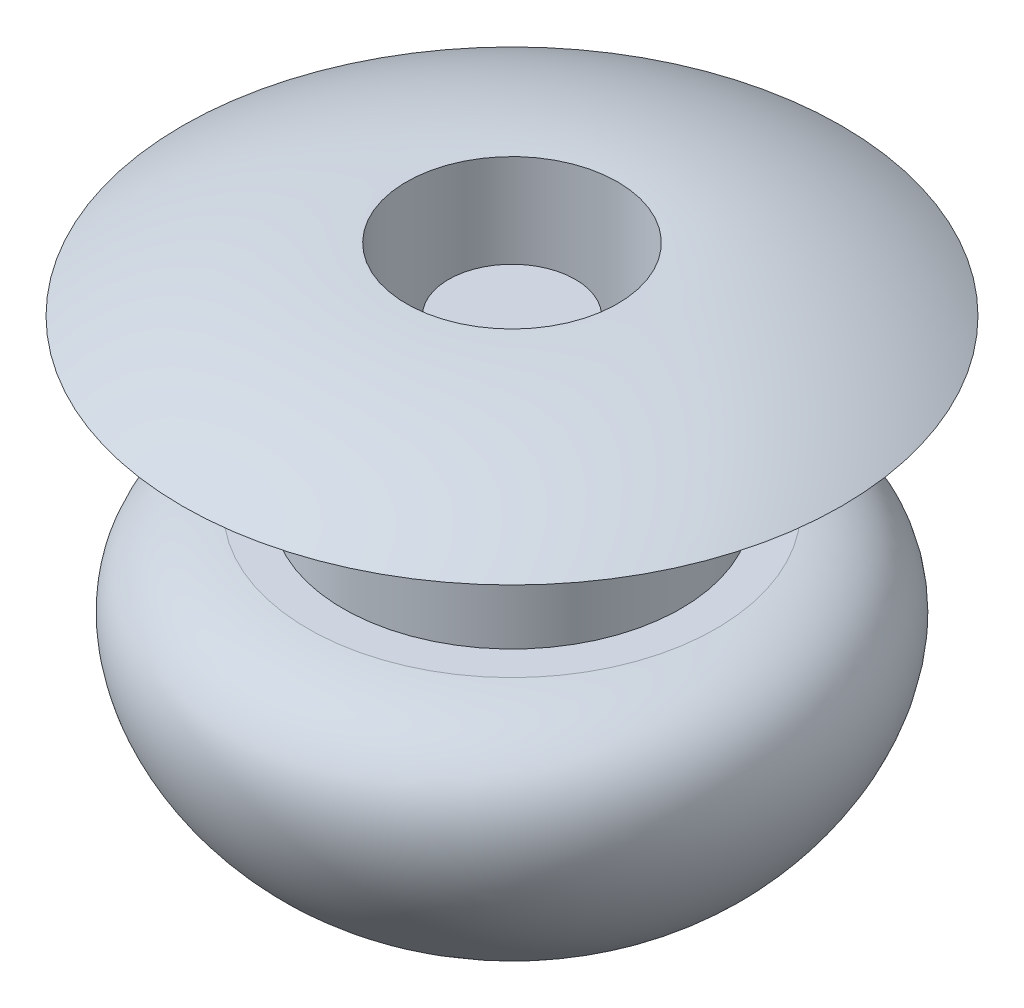
from build123d import *


with BuildPart() as part:
    # Szkic1 → Obrót1 (revolve)
    with BuildSketch(Plane(origin=(0, 0, 0), x_dir=(0, 0, -1), z_dir=(1, 0, 0))):
        with BuildLine():
            Line((0, 0), (0, -2.000000728))
            Line((0, -2.000000728), (0, -3.500000728))
            add(Edge.make_bspline(
                [(-0.956030427, -3.378191399), (-0.520263876, -3.500000728), (0, -3.500000728)],
                knots=[0.992852221, 0.992852221, 0.992852221, 1.570796327, 1.570796327, 1.570796327], degree=2, weights=[1, 0.958537313, 1]))
            add(Edge.make_bspline(
                [(-2.413891755, -2.000000728), (-3.858559437, -2.163297414), (-3.558358928, -4.32298109), (-0.971318098, -5.871940744), (-0.341145137, -3.792032638), (-0.956030427, -3.378191399)],
                knots=[0, 0, 0, 0, 0.454219308, 0.705200672, 1, 1, 1, 1], degree=3))
            Line((-2.413891755, -2.000000728), (-2, -2.000000728))
            Line((-2, -2.000000728), (-2, 0))
            Line((-2, 0), (-3.9, 0))
            ThreePointArc((-3.9, 0), (-2.627043935, 0.558888572), (-1.25, 0.75))
            Line((-1.25, 0.75), (-1.25, -2.000000728))
            Line((-1.25, -2.000000728), (-0.75, -2.000000728))
            Line((-0.75, -2.000000728), (-0.75, 0))
            Line((-0.75, 0), (0, 0))
        make_face()
    revolve(axis=Axis((0, 0, 0), (0, 1, 0)))


solid = part.part
